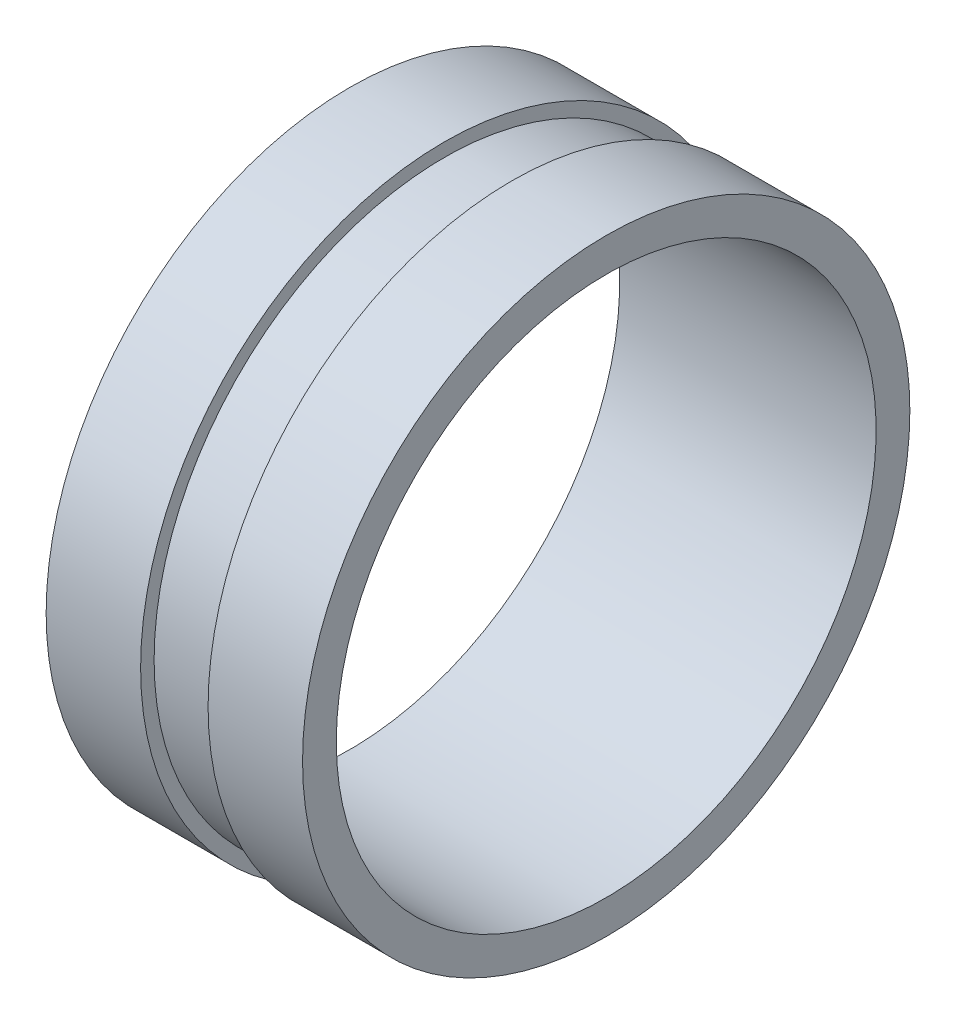
from build123d import *

# Parameters (mm, degrees)
SKETCH1_R           = 28.575
SKETCH1_R_2         = 25.4
BOSS_EXTRUDE1_DEPTH = 24.13


with BuildPart() as part:
    # Sketch1 → Boss-Extrude1 (new body)
    with BuildSketch(Plane(origin=(0, 0, 0), x_dir=(0, 0, -1), z_dir=(1, 0, 0))):
        Circle(SKETCH1_R)
        Circle(SKETCH1_R_2, mode=Mode.SUBTRACT)
    extrude(amount=BOSS_EXTRUDE1_DEPTH)

    # Cut-Sweep1: sweep along a curve in space
    with BuildLine() as cut_sweep1_path:
        ThreePointArc((24.13, 0, -28.575), (24.13, 20.205576272, -20.205576272), (24.13, 28.575, 0))
        ThreePointArc((24.13, 28.575, 0), (24.13, 20.205576272, 20.205576272), (24.13, 0, 28.575))
        ThreePointArc((24.13, 0, 28.575), (24.13, -20.205576272, 20.205576272), (24.13, -28.575, 0))
        ThreePointArc((24.13, -28.575, 0), (24.13, -20.205576272, -20.205576272), (24.13, 0, -28.575))
    # Sketch2 → Cut-Sweep1 (sweep, cut)
    with BuildSketch(Plane.XY):
        Polygon((15.24, 28.575), (15.24, 27.305), (8.89, 27.305), (8.89, 28.575), (8.89, 30.628551977), (15.24, 30.628551977), align=None)
    sweep(path=cut_sweep1_path.line, mode=Mode.SUBTRACT)


solid = part.part
